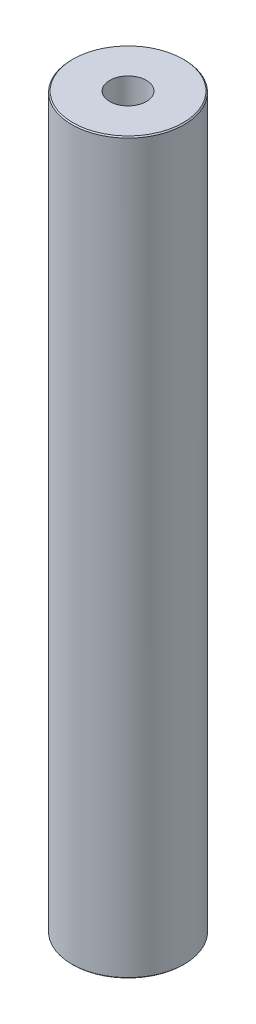
from build123d import *

# Parameters (mm, degrees)
SKETCH1_R           = 32.5
BOSS_EXTRUDE1_DEPTH = 421.437707118
SKETCH2_R           = 10.60832831
CUT_EXTRUDE1_DEPTH  = 424.93660019
CHAMFER1_SIZE       = 0.643373857


with BuildPart() as part:
    # Sketch1 → Boss-Extrude1 (new body)
    with BuildSketch(Plane(origin=(0, 0, 0), x_dir=(1, 0, 0), z_dir=(0, 1, 0))):
        Circle(SKETCH1_R)
    extrude(amount=BOSS_EXTRUDE1_DEPTH)

    # Sketch2 → Cut-Extrude1 (cut, through all)
    with BuildSketch(Plane(origin=(0, 0, 0), x_dir=(1, 0, 0), z_dir=(0, 1, 0))):
        Circle(SKETCH2_R)
    extrude(amount=CUT_EXTRUDE1_DEPTH, mode=Mode.SUBTRACT)

    # Chamfer1
    chamfer1_edges = [part.edges().sort_by_distance(p)[0] for p in [
        (-32.5, 421.437707118, 0),
        (-32.5, 0, 0),
    ]]
    chamfer(chamfer1_edges, length=CHAMFER1_SIZE)


solid = part.part
